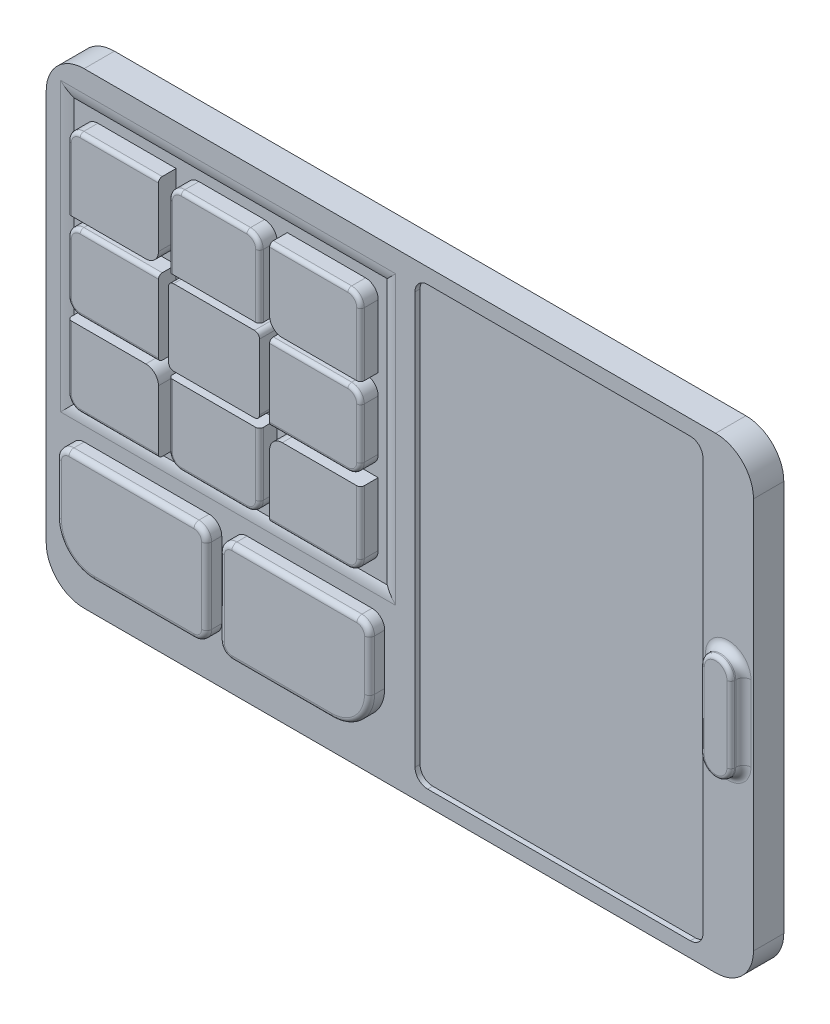
from build123d import *

# Parameters (mm, degrees)
SKETCH_2_W          = 280
SKETCH_2_H          = 185
EXTRUDE_1_DEPTH     = 12
CUT_EXTRUDE_START   = 12
SKETCH_2_4_W        = 124
SKETCH_2_4_H        = 105
CUT_EXTRUDE_1_DEPTH = 1
SKETCH_2_3_W        = 36
SKETCH_2_3_H        = 30
EXTRUDE_2_DEPTH     = 18
FILLET_1_R          = 10
SKETCH_2_5_W        = 114
SKETCH_2_5_H        = 173
CUT_EXTRUDE_2_DEPTH = 2
FILLET_3_R          = 5
SKETCH_2_7_W        = 59.5
SKETCH_2_7_H        = 40
EXTRUDE_3_DEPTH     = 18
FILLET_7_R          = 15
FILLET_8_R          = 5
FILLET_9_R          = 15
FILLET_10_R         = 5
EXTRUDE_4_DEPTH     = 5
FILLET_11_R         = 3
FILLET_12_R         = 1.5
FILLET_13_R         = 5
FILLET_14_R         = 5
FILLET_15_R         = 5
FILLET_16_R         = 2
FILLET_17_R         = 1.5
FILLET_18_R         = 2


with BuildPart() as part:
    # 草图2 → 凸台-拉伸1 (new body)
    with BuildSketch(Plane.XY):
        Rectangle(SKETCH_2_W, SKETCH_2_H)
    extrude(amount=EXTRUDE_1_DEPTH)

    # 草图2<4> → 切除-拉伸1 (cut)
    with BuildSketch(Plane.XY.offset(CUT_EXTRUDE_START)):
        with Locations((-68, 27)):
            Rectangle(SKETCH_2_4_W, SKETCH_2_4_H)
    extrude(amount=-CUT_EXTRUDE_1_DEPTH, mode=Mode.SUBTRACT)

    # 草图2<3> → 凸台-拉伸2 (add)
    with BuildSketch(Plane.XY):
        with Locations((-107.561904762, -5.5)):
            Rectangle(SKETCH_2_3_W, SKETCH_2_3_H)
        with Locations((-67.561904762, -5.5)):
            Rectangle(SKETCH_2_3_W, SKETCH_2_3_H)
        with Locations((-27.561904762, -5.5)):
            Rectangle(SKETCH_2_3_W, SKETCH_2_3_H)
        with Locations((-27.561904762, 27.5)):
            Rectangle(SKETCH_2_3_W, SKETCH_2_3_H)
        with Locations((-67.561904762, 27.5)):
            Rectangle(SKETCH_2_3_W, SKETCH_2_3_H)
        with Locations((-107.561904762, 27.5)):
            Rectangle(SKETCH_2_3_W, SKETCH_2_3_H)
        with Locations((-107.561904762, 60.5)):
            Rectangle(SKETCH_2_3_W, SKETCH_2_3_H)
        with Locations((-67.561904762, 60.5)):
            Rectangle(SKETCH_2_3_W, SKETCH_2_3_H)
        with Locations((-27.561904762, 60.5)):
            Rectangle(SKETCH_2_3_W, SKETCH_2_3_H)
    extrude(amount=EXTRUDE_2_DEPTH)

    # 圆角1
    # the kernel refuses this fillet: 10 mm, written as the material it takes off along each edge
    with BuildSketch(Plane(origin=(-130, -25.5, 12), x_dir=(-1, 0, 0), z_dir=(0, 1, 0)), Plane(origin=(-6, 79.5, 12), x_dir=(1, 0, 0), z_dir=(0, -1, 0))) as fillet_1_piece_1:
        with BuildLine():
            CenterArc((4.358898944, -10), FILLET_1_R, 90, 25.841932763)
            Line((0, -1), (-0.087177979, -0.82))
            ThreePointArc((-0.087177979, -0.82), (-0.2, -0.5), (-0.2, 0))
            Line((-0.2, 0), (0, 0.2))
            Line((0, 0.2), (4.358898944, 0.2))
            Line((4.358898944, 0.2), (4.358898944, 0))
        make_face()
    extrude(amount=105, mode=Mode.SUBTRACT)
    with BuildSketch(Plane(origin=(-6, -25.5, 12), x_dir=(0, -1, 0), z_dir=(-1, 0, 0)), Plane(origin=(-130, 79.5, 12), x_dir=(0, 1, 0), z_dir=(1, 0, 0))) as fillet_1_piece_2:
        with BuildLine():
            CenterArc((4.358898944, -10), FILLET_1_R, 90, 25.841932763)
            Line((0, -1), (-0.087177979, -0.82))
            ThreePointArc((-0.087177979, -0.82), (-0.2, -0.5), (-0.2, 0))
            Line((-0.2, 0), (0, 0.2))
            Line((0, 0.2), (4.358898944, 0.2))
            Line((4.358898944, 0.2), (4.358898944, 0))
        make_face()
    extrude(amount=124, mode=Mode.SUBTRACT)
    with BuildSketch(Plane(origin=(-6, -25.5, 12), x_dir=(0, -1, 0), z_dir=(-1, 0, 0))) as fillet_1_piece_3a_section:
        with BuildLine():
            CenterArc((4.358898944, -10), FILLET_1_R, 90, 25.841932763)
            Line((0, -1), (-0.087177979, -0.82))
            ThreePointArc((-0.087177979, -0.82), (-0.2, -0.5), (-0.2, 0))
            Line((-0.2, 0), (0, 0.2))
            Line((0, 0.2), (4.358898944, 0.2))
            Line((4.358898944, 0.2), (4.358898944, 0))
        make_face()
    fillet_1_piece_3a = extrude(amount=134.897247359, mode=Mode.PRIVATE)
    fillet_1_piece_3a = split(fillet_1_piece_3a, bisect_by=Plane(origin=(-130, -26.878270395, 11.838876431), z_dir=(-1, 0, 0)), keep=Keep.TOP, mode=Mode.PRIVATE)
    with BuildSketch(Plane(origin=(-130, -36.397247359, 12), x_dir=(-1, 0, 0), z_dir=(0, 1, 0))) as fillet_1_piece_3b_section:
        with BuildLine():
            CenterArc((4.358898944, -10), FILLET_1_R, 90, 25.841932763)
            Line((0, -1), (-0.087177979, -0.82))
            ThreePointArc((-0.087177979, -0.82), (-0.2, -0.5), (-0.2, 0))
            Line((-0.2, 0), (0, 0.2))
            Line((0, 0.2), (4.358898944, 0.2))
            Line((4.358898944, 0.2), (4.358898944, 0))
        make_face()
    fillet_1_piece_3b = extrude(amount=115.897247359, mode=Mode.PRIVATE)
    fillet_1_piece_3b = split(fillet_1_piece_3b, bisect_by=Plane(origin=(-131.378270395, -25.5, 11.838876431), z_dir=(0, -1, 0)), keep=Keep.TOP, mode=Mode.PRIVATE)
    fillet_1_piece_3 = fillet_1_piece_3a & fillet_1_piece_3b
    add(fillet_1_piece_3, mode=Mode.SUBTRACT)
    with BuildSketch(Plane(origin=(-140.897247359, 79.5, 12), x_dir=(0, 1, 0), z_dir=(1, 0, 0))) as fillet_1_piece_4a_section:
        with BuildLine():
            CenterArc((4.358898944, -10), FILLET_1_R, 90, 25.841932763)
            Line((0, -1), (-0.087177979, -0.82))
            ThreePointArc((-0.087177979, -0.82), (-0.2, -0.5), (-0.2, 0))
            Line((-0.2, 0), (0, 0.2))
            Line((0, 0.2), (4.358898944, 0.2))
            Line((4.358898944, 0.2), (4.358898944, 0))
        make_face()
    fillet_1_piece_4a = extrude(amount=134.897247359, mode=Mode.PRIVATE)
    fillet_1_piece_4a = split(fillet_1_piece_4a, bisect_by=Plane(origin=(-130, 80.878270395, 11.838876431), z_dir=(-1, 0, 0)), keep=Keep.TOP, mode=Mode.PRIVATE)
    with BuildSketch(Plane(origin=(-130, -25.5, 12), x_dir=(-1, 0, 0), z_dir=(0, 1, 0))) as fillet_1_piece_4b_section:
        with BuildLine():
            CenterArc((4.358898944, -10), FILLET_1_R, 90, 25.841932763)
            Line((0, -1), (-0.087177979, -0.82))
            ThreePointArc((-0.087177979, -0.82), (-0.2, -0.5), (-0.2, 0))
            Line((-0.2, 0), (0, 0.2))
            Line((0, 0.2), (4.358898944, 0.2))
            Line((4.358898944, 0.2), (4.358898944, 0))
        make_face()
    fillet_1_piece_4b = extrude(amount=115.897247359, mode=Mode.PRIVATE)
    fillet_1_piece_4b = split(fillet_1_piece_4b, bisect_by=Plane(origin=(-131.378270395, 79.5, 11.838876431), z_dir=(0, 1, 0)), keep=Keep.TOP, mode=Mode.PRIVATE)
    fillet_1_piece_4 = fillet_1_piece_4a & fillet_1_piece_4b
    add(fillet_1_piece_4, mode=Mode.SUBTRACT)
    with BuildSketch(Plane(origin=(-6, 79.5, 12), x_dir=(1, 0, 0), z_dir=(0, -1, 0))) as fillet_1_piece_5a_section:
        with BuildLine():
            CenterArc((4.358898944, -10), FILLET_1_R, 90, 25.841932763)
            Line((0, -1), (-0.087177979, -0.82))
            ThreePointArc((-0.087177979, -0.82), (-0.2, -0.5), (-0.2, 0))
            Line((-0.2, 0), (0, 0.2))
            Line((0, 0.2), (4.358898944, 0.2))
            Line((4.358898944, 0.2), (4.358898944, 0))
        make_face()
    fillet_1_piece_5a = extrude(amount=115.897247359, mode=Mode.PRIVATE)
    fillet_1_piece_5a = split(fillet_1_piece_5a, bisect_by=Plane(origin=(-4.621729605, -25.5, 11.838876431), z_dir=(0, -1, 0)), keep=Keep.TOP, mode=Mode.PRIVATE)
    with BuildSketch(Plane(origin=(4.897247359, -25.5, 12), x_dir=(0, -1, 0), z_dir=(-1, 0, 0))) as fillet_1_piece_5b_section:
        with BuildLine():
            CenterArc((4.358898944, -10), FILLET_1_R, 90, 25.841932763)
            Line((0, -1), (-0.087177979, -0.82))
            ThreePointArc((-0.087177979, -0.82), (-0.2, -0.5), (-0.2, 0))
            Line((-0.2, 0), (0, 0.2))
            Line((0, 0.2), (4.358898944, 0.2))
            Line((4.358898944, 0.2), (4.358898944, 0))
        make_face()
    fillet_1_piece_5b = extrude(amount=134.897247359, mode=Mode.PRIVATE)
    fillet_1_piece_5b = split(fillet_1_piece_5b, bisect_by=Plane(origin=(-6, -26.878270395, 11.838876431), z_dir=(1, 0, 0)), keep=Keep.TOP, mode=Mode.PRIVATE)
    fillet_1_piece_5 = fillet_1_piece_5a & fillet_1_piece_5b
    add(fillet_1_piece_5, mode=Mode.SUBTRACT)
    with BuildSketch(Plane(origin=(-130, 79.5, 12), x_dir=(0, 1, 0), z_dir=(1, 0, 0))) as fillet_1_piece_6a_section:
        with BuildLine():
            CenterArc((4.358898944, -10), FILLET_1_R, 90, 25.841932763)
            Line((0, -1), (-0.087177979, -0.82))
            ThreePointArc((-0.087177979, -0.82), (-0.2, -0.5), (-0.2, 0))
            Line((-0.2, 0), (0, 0.2))
            Line((0, 0.2), (4.358898944, 0.2))
            Line((4.358898944, 0.2), (4.358898944, 0))
        make_face()
    fillet_1_piece_6a = extrude(amount=134.897247359, mode=Mode.PRIVATE)
    fillet_1_piece_6a = split(fillet_1_piece_6a, bisect_by=Plane(origin=(-6, 80.878270395, 11.838876431), z_dir=(1, 0, 0)), keep=Keep.TOP, mode=Mode.PRIVATE)
    with BuildSketch(Plane(origin=(-6, 90.397247359, 12), x_dir=(1, 0, 0), z_dir=(0, -1, 0))) as fillet_1_piece_6b_section:
        with BuildLine():
            CenterArc((4.358898944, -10), FILLET_1_R, 90, 25.841932763)
            Line((0, -1), (-0.087177979, -0.82))
            ThreePointArc((-0.087177979, -0.82), (-0.2, -0.5), (-0.2, 0))
            Line((-0.2, 0), (0, 0.2))
            Line((0, 0.2), (4.358898944, 0.2))
            Line((4.358898944, 0.2), (4.358898944, 0))
        make_face()
    fillet_1_piece_6b = extrude(amount=115.897247359, mode=Mode.PRIVATE)
    fillet_1_piece_6b = split(fillet_1_piece_6b, bisect_by=Plane(origin=(-4.621729605, 79.5, 11.838876431), z_dir=(0, 1, 0)), keep=Keep.TOP, mode=Mode.PRIVATE)
    fillet_1_piece_6 = fillet_1_piece_6a & fillet_1_piece_6b
    add(fillet_1_piece_6, mode=Mode.SUBTRACT)

    # 草图2<5> → 切除-拉伸2 (cut)
    with BuildSketch(Plane.XY.offset(CUT_EXTRUDE_START)):
        with Locations((63, 0)):
            Rectangle(SKETCH_2_5_W, SKETCH_2_5_H)
    extrude(amount=-CUT_EXTRUDE_2_DEPTH, mode=Mode.SUBTRACT)

    # 圆角3
    fillet_3_edges = [part.edges().sort_by_distance(p)[0] for p in [
        (120, -86.5, 11),
        (6, -86.5, 11),
        (6, 86.5, 11),
        (120, 86.5, 11),
    ]]
    fillet(fillet_3_edges, radius=FILLET_3_R)

    # 草图2<7> → 凸台-拉伸3 (add)
    with BuildSketch(Plane.XY):
        with Locations((-100.25, -55.5)):
            Rectangle(SKETCH_2_7_W, SKETCH_2_7_H)
        with Locations((-35.75, -55.5)):
            Rectangle(SKETCH_2_7_W, SKETCH_2_7_H)
    extrude(amount=EXTRUDE_3_DEPTH)

    # 圆角7
    fillet_7_edges = [part.edges().sort_by_distance(p)[0] for p in [
        (-140, 92.5, 6),
        (140, 92.5, 6),
        (140, -92.5, 6),
        (-140, -92.5, 6),
    ]]
    fillet(fillet_7_edges, radius=FILLET_7_R)

    # 圆角8
    fillet_8_edges = [part.edges().sort_by_distance(p)[0] for p in [
        (-70.5, -35.5, 15),
        (-130, -35.5, 15),
        (-6, -35.5, 15),
        (-65.5, -35.5, 15),
        (-65.5, -75.5, 15),
    ]]
    fillet(fillet_8_edges, radius=FILLET_8_R)

    # 圆角9
    fillet_9_edges = [part.edges().sort_by_distance(p)[0] for p in [
        (-130, -75.5, 15),
        (-6, -75.5, 15),
    ]]
    fillet(fillet_9_edges, radius=FILLET_9_R)

    # 圆角10
    fillet_10_edges = [part.edges().sort_by_distance(p)[0] for p in [
        (-125.561904762, 75.5, 14.5),
        (-9.561904762, 75.5, 14.5),
        (-125.561904762, -20.5, 14.5),
        (-9.561904762, -20.5, 14.5),
    ]]
    fillet(fillet_10_edges, radius=FILLET_10_R)

    # 草图4 → 凸台-拉伸4 (add)
    with BuildSketch(Plane.XY.offset(12)):
        with BuildLine():
            Line((136, 15), (136, -15))
            ThreePointArc((136, -15), (130, -21), (124, -15))
            Line((124, -15), (124, 15))
            ThreePointArc((124, 15), (130, 21), (136, 15))
        make_face()
    extrude(amount=EXTRUDE_4_DEPTH)

    # 圆角11
    fillet_11_edges = [part.edges().sort_by_distance(p)[0] for p in [
        (130, 21, 12),
        (124, 0, 12),
        (130, -21, 12),
        (136, 0, 12),
    ]]
    fillet(fillet_11_edges, radius=FILLET_11_R)

    # 圆角12
    fillet_12_edges = [part.edges().sort_by_distance(p)[0] for p in [
        (130, 21, 17),
        (124, 0, 17),
        (130, -21, 17),
        (136, 0, 17),
    ]]
    fillet(fillet_12_edges, radius=FILLET_12_R)

    # 圆角13
    fillet_13_edges = [part.edges().sort_by_distance(p)[0] for p in [
        (-70.5, -75.5, 15),
    ]]
    fillet(fillet_13_edges, radius=FILLET_13_R)

    # 圆角14
    fillet_14_edges = [part.edges().sort_by_distance(p)[0] for p in [
        (-89.561904762, 45.5, 14.5),
        (-45.561904762, 45.5, 14.5),
        (-89.561904762, 9.5, 14.5),
        (-45.561904762, 9.5, 14.5),
    ]]
    fillet(fillet_14_edges, radius=FILLET_14_R)

    # 圆角15
    fillet_15_edges = [part.edges().sort_by_distance(p)[0] for p in [
        (-125.561904762, 42.5, 14.5),
        (-125.561904762, 12.5, 14.5),
        (-85.561904762, 75.5, 14.5),
        (-49.561904762, 75.5, 14.5),
        (-85.561904762, -20.5, 14.5),
        (-49.561904762, -20.5, 14.5),
        (-9.561904762, 12.5, 14.5),
        (-9.561904762, 42.5, 14.5),
    ]]
    fillet(fillet_15_edges, radius=FILLET_15_R)

    # 圆角16
    fillet_16_edges = [part.edges().sort_by_distance(p)[0] for p in [
        (-130, -50.5, 18),
        (-100.25, -35.5, 18),
        (-70.5, -55.5, 18),
        (-71.964466094, -36.964466094, 18),
        (-128.535533906, -36.964466094, 18),
        (-40.75, -75.5, 18),
        (-65.5, -55.5, 18),
        (-35.75, -35.5, 18),
        (-6, -50.5, 18),
        (-7.464466094, -36.964466094, 18),
        (-64.035533906, -36.964466094, 18),
        (-64.035533906, -74.035533906, 18),
        (-10.393398282, -71.106601718, 18),
        (-95.25, -75.5, 18),
        (-125.606601718, -71.106601718, 18),
        (-71.964466094, -74.035533906, 18),
    ]]
    fillet(fillet_16_edges, radius=FILLET_16_R)

    # 圆角17
    fillet_17_edges = [part.edges().sort_by_distance(p)[0] for p in [
        (-30.061904762, 75.5, 18),
        (-125.561904762, -3, 18),
        (-125.561904762, 58, 18),
        (-105.061904762, 75.5, 18),
        (-124.097438668, 74.035533906, 18),
        (-105.061904762, -20.5, 18),
        (-124.097438668, -19.035533906, 18),
        (-11.026370856, -19.035533906, 18),
        (-9.561904762, 58, 18),
        (-11.026370856, 74.035533906, 18),
        (-49.561904762, -3, 18),
        (-85.561904762, -3, 18),
        (-67.561904762, -20.5, 18),
        (-84.097438668, -19.035533906, 18),
        (-51.026370856, -19.035533906, 18),
        (-85.561904762, 58, 18),
        (-67.561904762, 75.5, 18),
        (-49.561904762, 58, 18),
        (-51.026370856, 74.035533906, 18),
        (-84.097438668, 74.035533906, 18),
        (-9.561904762, 27.5, 18),
        (-11.026370856, 41.035533906, 18),
        (-11.026370856, 13.964466094, 18),
        (-105.061904762, 12.5, 18),
        (-125.561904762, 27.5, 18),
        (-105.061904762, 42.5, 18),
        (-124.097438668, 41.035533906, 18),
        (-124.097438668, 13.964466094, 18),
        (-9.561904762, -3, 18),
        (-30.061904762, -20.5, 18),
        (-30.061904762, 42.5, 18),
        (-30.061904762, 12.5, 18),
    ]]
    fillet(fillet_17_edges, radius=FILLET_17_R)

    # 圆角18
    fillet_18_edges = [part.edges().sort_by_distance(p)[0] for p in [
        (-85.561904762, 42.5, 14.5),
        (-85.561904762, 12.5, 14.5),
        (-49.561904762, 12.5, 14.5),
        (-49.561904762, 42.5, 14.5),
    ]]
    fillet(fillet_18_edges, radius=FILLET_18_R)


solid = part.part
